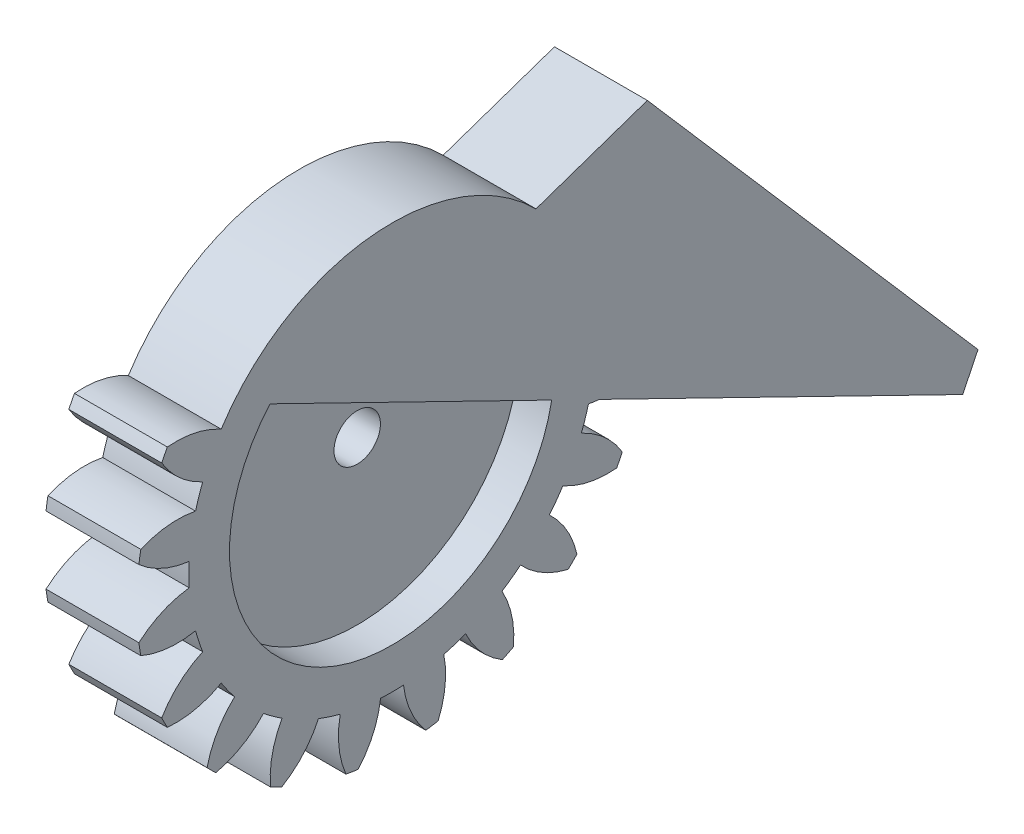
from build123d import *

# Parameters (mm, degrees)
BASPROSKE_W         = 8
BASPROSKE_H         = 22
TOOTHCUT_DEPTH      = 33.124756808
TEETHCUTS_COUNT     = 20
TEETHCUTS_ANGLE     = 342
BORSKE_R            = 2
BORE_DEPTH          = 8
SKETCH1_R           = 14
CUT_EXTRUDE1_DEPTH  = 3
CUT_EXTRUDE2_DEPTH  = 32.859573128
BOSS_EXTRUDE1_DEPTH = 8
CUT_EXTRUDE3_DEPTH  = 66.194920127
CHAMFER1_SIZE       = 30


with BuildPart() as part:
    # BasProSke → Base-Revolve (revolve)
    with BuildSketch(Plane(origin=(0, 0, 0), x_dir=(1, 0, 0), z_dir=(0, 1, 0)), mode=Mode.PRIVATE) as base_revolve_sk:
        with Locations((4, 11)):
            Rectangle(BASPROSKE_W, BASPROSKE_H)
    revolve(base_revolve_sk.sketch.rotate(Axis((-10, 0, 0), (1, 0, 0)), 180), axis=Axis((-10, 0, 0), (1, 0, 0)))

    # TooCutSke → ToothCut (cut, through all)
    with BuildSketch(Plane(origin=(0, 0, 0), x_dir=(0, 0, -1), z_dir=(1, 0, 0))):
        with BuildLine():
            ThreePointArc((0.986171591, 17.471189616), (0, 17.499), (-0.986171591, 17.471189616))
            ThreePointArc((-0.986171591, 17.471189616), (-1.626916196, 19.798789858), (-2.932850173, 21.829260982))
            ThreePointArc((-2.932850173, 21.829260982), (0, 22.0254), (2.932850173, 21.829260982))
            ThreePointArc((2.932850173, 21.829260982), (1.626916196, 19.798789858), (0.986171591, 17.471189616))
        make_face()
    toothcut = extrude(amount=TOOTHCUT_DEPTH, mode=Mode.SUBTRACT)

    # TeethCuts: ToothCut ×20 about axis
    teethcuts_axis = Axis((-10, 0, 0), (1, 0, 0))
    for i in range(1, TEETHCUTS_COUNT):
        add(toothcut.rotate(teethcuts_axis, i * TEETHCUTS_ANGLE / (TEETHCUTS_COUNT - 1)), mode=Mode.SUBTRACT)

    # BorSke → Bore (cut, symmetric)
    with BuildSketch(Plane(origin=(0, 0, 0), x_dir=(0, 0, -1), z_dir=(1, 0, 0))):
        with Locations(Location((0, 0, 0), (0, 0, 180))):
            Circle(BORSKE_R)
    extrude(amount=BORE_DEPTH, both=True, mode=Mode.SUBTRACT)

    # Sketch1 → Cut-Extrude1 (cut)
    with BuildSketch(Plane(origin=(8, 0, 0), x_dir=(0, 0, -1), z_dir=(1, 0, 0))):
        Circle(SKETCH1_R)
    extrude(amount=-CUT_EXTRUDE1_DEPTH, mode=Mode.SUBTRACT)

    # Sketch2 → Cut-Extrude2 (cut, through all)
    with BuildSketch(Plane.ZY):
        Polygon((-21.592193025, -6.419793995), (20.580067201, 14.175220465), (12.820897061, 30.063616315), (-23.756341743, 14.175220465), (-26.106914947, 1.214231969), align=None)
    extrude(amount=-CUT_EXTRUDE2_DEPTH, mode=Mode.SUBTRACT)

    # Sketch3 → Boss-Extrude1 (add)
    with BuildSketch(Plane.ZY):
        Polygon((13.740882365, 10.835273546), (-49.159279282, -19.882305538), (-57.935730449, -1.910830782), (4.964431198, 28.806748303), align=None)
    extrude(amount=-BOSS_EXTRUDE1_DEPTH)

    # Sketch6 → Cut-Extrude3 (cut, through all)
    with BuildSketch(Plane(origin=(8, 0, 0), x_dir=(0, 0, -1), z_dir=(1, 0, 0))):
        Polygon((50.475746957, -17.186584325), (57.935730449, -1.910830782), (21.992780936, 15.642071552), align=None)
    extrude(amount=-CUT_EXTRUDE3_DEPTH, mode=Mode.SUBTRACT)

    # Chamfer1
    # the kernel refuses this chamfer: 30 mm, written as the material it takes off along each edge
    with BuildSketch(Plane(origin=(-77.150489639, 28.806748303, 4.964431198), x_dir=(0, -0.4139495743409253, -0.9102998131950631), z_dir=(1, 0, 0))) as chamfer1_piece_1_section:
        Polygon((CHAMFER1_SIZE * 0.999621916911, -CHAMFER1_SIZE * 0.0274958766106), (-CHAMFER1_SIZE * 0.0274958766106, -CHAMFER1_SIZE * 0.999621916911), (0, 0), align=None)
    chamfer1_piece_1 = extrude(amount=162.300979278, mode=Mode.PRIVATE)
    chamfer1_piece_1 = chamfer1_piece_1 - Plane(origin=(2.5, 0, 0), x_dir=(0, 0.632443978109164, 0.7746061028377297), z_dir=(-1, 0, 0)) * Cylinder(17.499, 445, mode=Mode.PRIVATE)
    chamfer1_piece_1 = split(chamfer1_piece_1, bisect_by=Plane(origin=(2.5, 5.973711679, 3.785897747), z_dir=(0, 0.898573737810962, -0.43882255834954154)), keep=Keep.TOP, mode=Mode.PRIVATE)
    add(chamfer1_piece_1, mode=Mode.SUBTRACT)


solid = part.part
